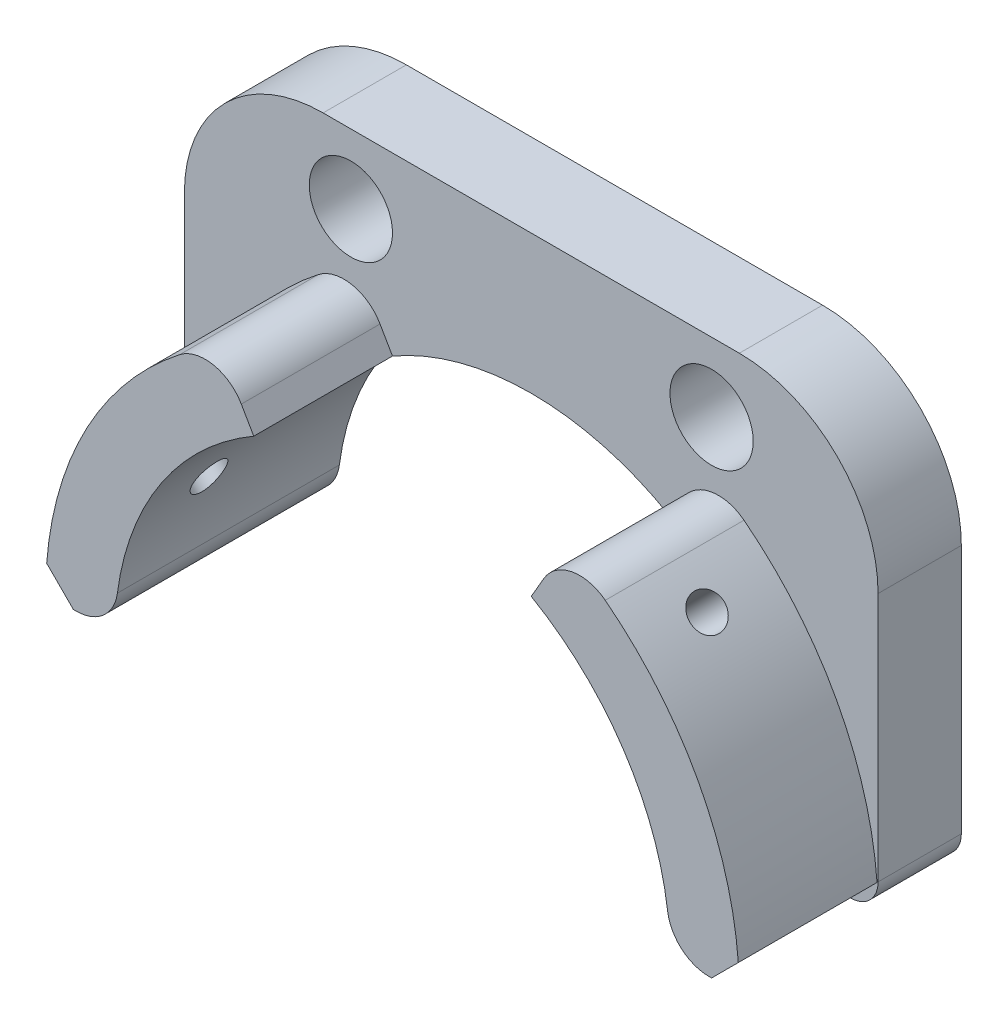
from build123d import *

# Parameters (mm, degrees)
BOSS_EXTRUDE1_DEPTH     = 6
BOSS_EXTRUDE2_DEPTH     = 10
BOSS_EXTRUDE3_DEPTH     = 6
SKETCH4_R               = 3
CUT_EXTRUDE1_DEPTH      = 41.311288741
TAP_DRILL_FOR_M3_TAP1_D = 2.5
TAP_DRILL_FOR_M3_TAP2_D = 2.5
CHAMFER1_SIZE           = 2
FILLET1_R               = 3
FILLET2_R               = 10
FILLET3_R               = 2


with BuildPart() as part:
    # Sketch1 → Boss-Extrude1 (new body)
    with BuildSketch(Plane.XY):
        with BuildLine():
            Line((20, 0), (25, 0))
            ThreePointArc((25, 0), (0, 25), (-25, 0))
            Line((-25, 0), (-20, 0))
            ThreePointArc((-20, 0), (0, 20), (20, 0))
        make_face()
    extrude(amount=BOSS_EXTRUDE1_DEPTH)

    # Sketch2 → Boss-Extrude2 (add)
    with BuildSketch(Plane.XY.offset(6)):
        with BuildLine():
            ThreePointArc((-20, 0), (-17.320508076, 10), (-10, 17.320508076))
            Line((-10, 17.320508076), (-12.5, 21.650635095))
            ThreePointArc((-12.5, 21.650635095), (-21.650635095, 12.5), (-25, 0))
            Line((-25, 0), (-20, 0))
        make_face()
        with BuildLine():
            Line((12.5, 21.650635095), (10, 17.320508076))
            ThreePointArc((10, 17.320508076), (17.320508076, 10), (20, 0))
            Line((20, 0), (25, 0))
            ThreePointArc((25, 0), (21.650635095, 12.5), (12.5, 21.650635095))
        make_face()
    extrude(amount=BOSS_EXTRUDE2_DEPTH)

    # Sketch3 → Boss-Extrude3 (add)
    with BuildSketch(Plane(origin=(0, 0, 0), x_dir=(-1, 0, 0), z_dir=(0, 0, -1))):
        with BuildLine():
            Line((-25, 0), (-25, 30))
            Line((-25, 30), (25, 30))
            Line((25, 30), (25, 0))
            ThreePointArc((25, 0), (0, 25), (-25, 0))
        make_face()
    extrude(amount=-BOSS_EXTRUDE3_DEPTH)

    # Sketch4 → Cut-Extrude1 (cut, through all)
    with BuildSketch(Plane.XY.offset(6)):
        with Locations((13, 25)):
            Circle(SKETCH4_R)
        with Locations((-13, 25)):
            Circle(SKETCH4_R)
    extrude(amount=-CUT_EXTRUDE1_DEPTH, mode=Mode.SUBTRACT)

    # Tap Drill for M3 Tap1 (through all)
    with Locations(Plane(origin=(-17.67766953, 17.67766953, 0), x_dir=(0, 0, -1), z_dir=(-0.7071067811865488, 0.7071067811865464, 0))):
        with Locations((-11, 7.071067812)):
            Hole(TAP_DRILL_FOR_M3_TAP1_D / 2)

    # Tap Drill for M3 Tap2 (through all)
    with Locations(Plane(origin=(17.67766953, 17.67766953, 0), x_dir=(0, 0, -1), z_dir=(0.7071067811865488, 0.7071067811865464, 0))):
        with Locations((-11, 0)):
            Hole(TAP_DRILL_FOR_M3_TAP2_D / 2)

    # Chamfer1
    # the kernel refuses this chamfer: 2 mm, written as the material it takes off along each edge
    with BuildSketch(Plane(origin=(-25, 0, 21.143365976), x_dir=(1, 0, 0), z_dir=(0, 0, -1))) as chamfer1_piece_1:
        with BuildLine():
            Line((CHAMFER1_SIZE, 0), (0.074278418, -1.925721582))
            ThreePointArc((0.074278418, -1.925721582), (0.019638133, -0.990717402), (0, 0))
            Line((0, 0), (CHAMFER1_SIZE, 0))
        make_face()
    extrude(amount=15.143365976, mode=Mode.SUBTRACT)
    with BuildSketch(Plane(origin=(25, 0, 21.143365976), x_dir=(-1, 0, 0), z_dir=(0, 0, -1))) as chamfer1_piece_2:
        with BuildLine():
            Line((CHAMFER1_SIZE, 0), (0.074278418, 1.925721582))
            ThreePointArc((0.074278418, 1.925721582), (0.019638133, 0.990717402), (0, 0))
            Line((0, 0), (CHAMFER1_SIZE, 0))
        make_face()
    extrude(amount=15.143365976, mode=Mode.SUBTRACT)

    # Fillet1
    fillet1_edges = [part.edges().sort_by_distance(p)[0] for p in [
        (-12.5, 21.650635095, 11),
        (12.5, 21.650635095, 11),
        (20, 0, 8),
        (-20, 0, 8),
    ]]
    fillet(fillet1_edges, radius=FILLET1_R)

    # Fillet2
    fillet2_edges = [part.edges().sort_by_distance(p)[0] for p in [
        (-25, 30, 3),
        (25, 30, 3),
    ]]
    fillet(fillet2_edges, radius=FILLET2_R)

    # Fillet3
    fillet3_edges = [part.edges().sort_by_distance(p)[0] for p in [
        (25, 0, 3),
        (-25, 0, 3),
    ]]
    fillet(fillet3_edges, radius=FILLET3_R)


solid = part.part
